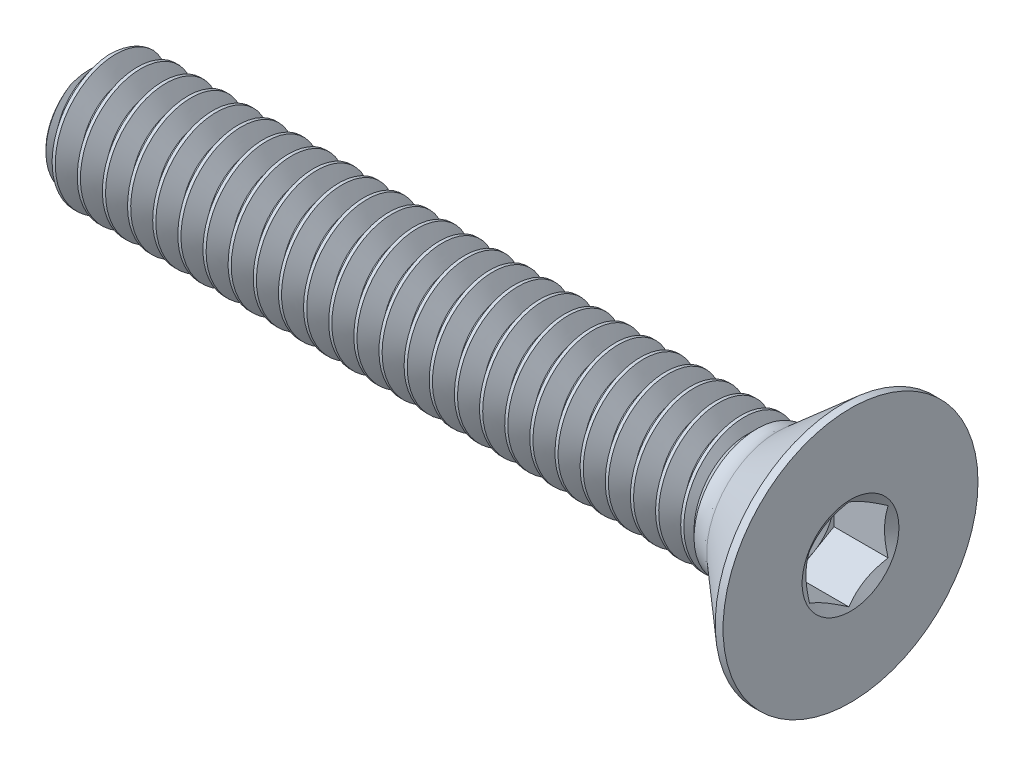
from build123d import *

# Parameters (mm, degrees)
CUT_EXTRUDE1_DEPTH = 2.8194
DELETEFACE1_START  = 14
DELETEFACE1_DEPTH  = 2.2306
CUT_SWEEP1_PITCH   = 1.27
CUT_SWEEP1_TO      = 34.389142


with BuildPart() as part:
    # Sketch3 → Revolve1 (revolve)
    with BuildSketch(Plane.XY, mode=Mode.PRIVATE) as revolve1_sk:
        with BuildLine():
            Line((-18.415, 3.175), (-19.05, 2.54))
            Line((-19.05, 2.54), (-19.05, 0))
            Line((-19.05, 0), (19.05, 0))
            Line((19.05, 0), (19.05, 6.4389))
            Line((19.05, 6.4389), (18.655538673, 6.4389))
            Line((18.655538673, 6.4389), (15.339141592, 3.556))
            ThreePointArc((15.339141592, 3.556), (14.864074209, 3.273364608), (14.320110803, 3.175))
            Line((14.320110803, 3.175), (-18.415, 3.175))
        make_face()
    revolve(revolve1_sk.sketch.rotate(Axis((19.05, 0, 0), (-1, 0, 0)), 90), axis=Axis((19.05, 0, 0), (-1, 0, 0)))

    # Sketch4 → Cut-Extrude1 (cut)
    with BuildSketch(Plane(origin=(19.05, 0, 0), x_dir=(0, 0, -1), z_dir=(1, 0, 0))):
        Polygon((0, 2.291358881), (-1.984375, 1.14567944), (-1.984375, -1.14567944), (0, -2.291358881), (1.984375, -1.14567944), (1.984375, 1.14567944), align=None)
    extrude(amount=-CUT_EXTRUDE1_DEPTH, mode=Mode.SUBTRACT)

    # Cut-Extrude2 cone 1 section (through the dimple's axis) → Cut-Extrude2 (revolve, cut)
    with BuildSketch(Plane(origin=(19.05, 0, 0), x_dir=(0, 0, -1), z_dir=(0, 1, 0))):
        Polygon((0, 0), (2.444850821, 0), (0, 1.41153528), align=None)
    revolve(axis=Axis((19.05, 0, 0), (-1, 0, 0)), mode=Mode.SUBTRACT)

    # Cut-Extrude3 cone 1 section (through the dimple's axis) → Cut-Extrude3 (revolve, cut)
    with BuildSketch(Plane(origin=(16.2306, 0, 0), x_dir=(0, 0, -1), z_dir=(0, 1, 0))):
        Polygon((0, 0), (1.984375, 0), (0, 1.14567944), align=None)
    revolve(axis=Axis((16.2306, 0, 0), (-1, 0, 0)), mode=Mode.SUBTRACT)

    # DeleteFace1: read off the stored shape, not the designer's step
    # DeleteFace1 outline → DeleteFace1 (add)
    with BuildSketch(Plane.YZ.offset(DELETEFACE1_START)):
        Polygon((-1.14567944, -1.984375), (1.14567944, -1.984375), (2.291358881, 0), (1.14567944, 1.984375), (-1.14567944, 1.984375), (-2.291358881, 0), align=None)
    extrude(amount=DELETEFACE1_DEPTH)


with BuildPart() as body_2:
    # Split1: the piece on the far side of the plane
    add(part.part)
    split(bisect_by=Plane(origin=(15.339141592, 0, 0), x_dir=(0, 0, 1), z_dir=(1, 0, 0)), keep=Keep.BOTTOM)

    # Cut-Sweep1: arcs per turn and ends read off the stored shape
    # Cut-Sweep1: the profile of Sketch7 screwed along a right-hand helix through 30 turns, 8 arcs to a turn; built about Z, then put on its axis
    cut_sweep1_z = Axis((0, 0, 0), (0, 0, 1))
    cut_sweep1_corners = [(2.350110803, 0, -0.635), (3.243740766, 0, -1.1509375), (3.243740766, 0, 0.0396875), (2.350110803, 0, -0.47625)]
    with BuildLine(mode=Mode.PRIVATE) as cut_sweep1_profile:
        Line(cut_sweep1_corners[0], cut_sweep1_corners[1])
        Line(cut_sweep1_corners[1], cut_sweep1_corners[2])
        Line(cut_sweep1_corners[2], cut_sweep1_corners[3])
        Line(cut_sweep1_corners[3], cut_sweep1_corners[0])
    cut_sweep1_cap = Face(cut_sweep1_profile.wire())
    cut_sweep1_turn_angles = [0, 22.5, 45, 67.5, 90, 112.5, 135, 157.5, 180, 202.5, 225, 247.5, 270, 292.5, 315, 337.5, 360]
    cut_sweep1_turn_weights = [1, 0.9238795325112867, 1, 0.9238795325112867, 1, 0.9238795325112867, 1, 0.9238795325112867, 1, 0.9238795325112867, 1, 0.9238795325112867, 1, 0.9238795325112867, 1, 0.9238795325112867, 1]
    cut_sweep1_turn_rails = [Edge.make_bspline([Vector(p[0], p[1], 0).rotate(cut_sweep1_z, cut_sweep1_turn_angles[k]) / cut_sweep1_turn_weights[k] + Vector(0, 0, p[2] + CUT_SWEEP1_PITCH * cut_sweep1_turn_angles[k] / 360) for k in range(17)], [0, 0, 0, 1, 1, 2, 2, 3, 3, 4, 4, 5, 5, 6, 6, 7, 7, 8, 8, 8], 2, cut_sweep1_turn_weights) for p in cut_sweep1_corners]
    cut_sweep1_turn_sides = [Face.make_surface_from_curves(cut_sweep1_turn_rails[p[0]], cut_sweep1_turn_rails[p[1]]) for p in [(0, 1), (1, 2), (2, 3), (3, 0)]]
    cut_sweep1 = Plane(origin=(-19.05, 0, 0), x_dir=(0, -1, 0), z_dir=(1, 0, 0)) * split(Solid(Shell([*[p.moved(Location((0, 0, CUT_SWEEP1_PITCH * i))) for i in range(30) for p in cut_sweep1_turn_sides], cut_sweep1_cap, cut_sweep1_cap.rotate(cut_sweep1_z, 10800).moved(Location((0, 0, CUT_SWEEP1_PITCH * 10800 / 360)))])), bisect_by=Plane.XY.offset(CUT_SWEEP1_TO), keep=Keep.BOTTOM, mode=Mode.PRIVATE)
    add(cut_sweep1, mode=Mode.SUBTRACT)


with BuildPart() as part_1:
    add(part.part)

    # Split1
    split(bisect_by=Plane(origin=(15.339141592, 0, 0), x_dir=(0, 0, 1), z_dir=(1, 0, 0)), keep=Keep.TOP)

    add(body_2.part)  # Revolve2 merges body 2
    # Sketch9 → Revolve2 (revolve)
    with BuildSketch(Plane.XY, mode=Mode.PRIVATE) as revolve2_sk:
        with BuildLine():
            Line((14.320110803, 3.175), (14.320110803, 0))
            Line((14.320110803, 0), (15.339141592, 0))
            Line((15.339141592, 0), (15.339141592, 3.556))
            ThreePointArc((15.339141592, 3.556), (14.864074209, 3.273364608), (14.320110803, 3.175))
        make_face()
    revolve(revolve2_sk.sketch.rotate(Axis((14.320110803, 0, 0), (1, 0, 0)), 270), axis=Axis((14.320110803, 0, 0), (1, 0, 0)))

    # Cut-Extrude4 cone 1 section (through the dimple's axis) → Cut-Extrude4 (revolve, cut)
    with BuildSketch(Plane(origin=(16.2306, 0, 0), x_dir=(0, 0, -1), z_dir=(0, 1, 0))):
        Polygon((0, 0), (1.984375, 0), (0, 1.14567944), align=None)
    revolve(axis=Axis((16.2306, 0, 0), (-1, 0, 0)), mode=Mode.SUBTRACT)

    # Boss-Extrude1: read off the stored shape, not the designer's step
    # Boss-Extrude1 outline → Boss-Extrude1 (revolve)
    with BuildSketch(Plane.YX):
        Polygon((2.350106396, 14.320110803), (2.350106396, 13.495217199), (3.175, 14.320110803), align=None)
    revolve(axis=Axis((0, 0, 0), (1, 0, 0)))


solid = part_1.part
